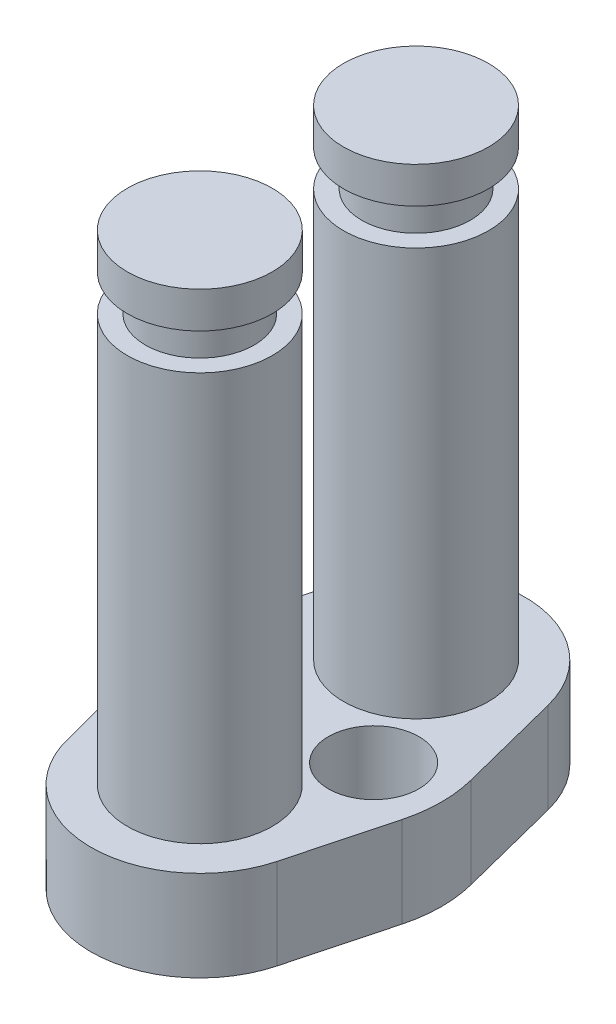
from build123d import *

# Parameters (mm, degrees)
SKETCH2_R           = 2.5
BOSS_EXTRUDE2_DEPTH = 5
SKETCH3_R           = 4
BOSS_EXTRUDE3_DEPTH = 22.5
SKETCH4_R           = 3
BOSS_EXTRUDE4_DEPTH = 2
SKETCH5_R           = 4
BOSS_EXTRUDE5_DEPTH = 2


with BuildPart() as part:
    # Sketch2 → Boss-Extrude2 (new body)
    with BuildSketch(Plane(origin=(0, 0, 0), x_dir=(1, 0, 0), z_dir=(0, 1, 0))):
        with BuildLine():
            Line((-3.493426606, -1.944934706), (-1.921673483, -7.798539123))
            ThreePointArc((-1.921673483, -7.798539123), (3.967844549, -11.837003018), (9.548776015, -7.381801872))
            Line((9.548776015, -7.381801872), (10.998470019, -1.926053578))
            ThreePointArc((10.998470019, -1.926053578), (11.24988985, -0.04064778), (11.018921171, 1.84737246))
            Line((11.018921171, 1.84737246), (9.565136937, 7.567628243))
            ThreePointArc((9.565136937, 7.567628243), (3.75, 12.089730275), (-2.065136937, 7.567628243))
            Line((-2.065136937, 7.567628243), (-3.518921171, 1.84737246))
            ThreePointArc((-3.518921171, 1.84737246), (-3.749830525, -0.050419155), (-3.493426606, -1.944934706))
        make_face()
        Circle(SKETCH2_R, mode=Mode.SUBTRACT)
        with Locations((7.5, 0)):
            Circle(SKETCH2_R, mode=Mode.SUBTRACT)
    extrude(amount=BOSS_EXTRUDE2_DEPTH)

    # Sketch3 → Boss-Extrude3 (add)
    with BuildSketch(Plane(origin=(0, 5, 0), x_dir=(1, 0, 0), z_dir=(0, 1, 0))):
        with Locations((3.75, -5.840959009)):
            Circle(SKETCH3_R)
        with Locations((3.75, 6.089730275)):
            Circle(SKETCH3_R)
    extrude(amount=BOSS_EXTRUDE3_DEPTH)

    # Sketch4 → Boss-Extrude4 (add)
    with BuildSketch(Plane(origin=(0, 27.5, 0), x_dir=(1, 0, 0), z_dir=(0, 1, 0))):
        with Locations((3.75, -5.840959009)):
            Circle(SKETCH4_R)
        with Locations((3.75, 6.089730275)):
            Circle(SKETCH4_R)
    extrude(amount=BOSS_EXTRUDE4_DEPTH)

    # Sketch5 → Boss-Extrude5 (add)
    with BuildSketch(Plane(origin=(0, 29.5, 0), x_dir=(1, 0, 0), z_dir=(0, 1, 0))):
        with Locations((3.75, -5.840959009)):
            Circle(SKETCH5_R)
        with Locations((3.75, 6.089730275)):
            Circle(SKETCH5_R)
    extrude(amount=BOSS_EXTRUDE5_DEPTH)


solid = part.part
